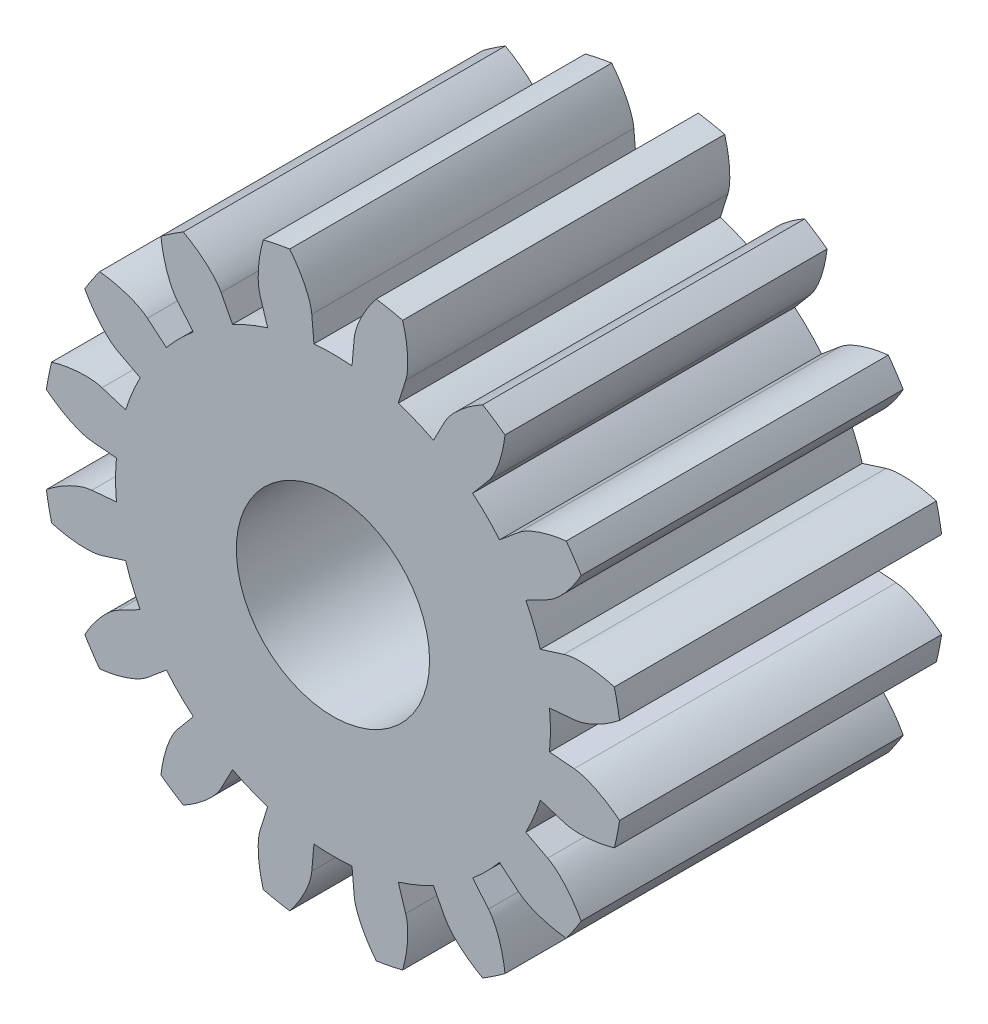
from build123d import *

# Parameters (mm, degrees)
SKETCH_1_R               = 4.5
SKETCH_1_R_2             = 1.5
EXTRUDE_1_DEPTH          = 5
CUT_EXTRUDE_1_DEPTH      = 9.093207028
PATTERN_CIRCULAR_1_COUNT = 16
PATTERN_CIRCULAR_1_ANGLE = 337.5


with BuildPart() as part:
    # 草图1 → 凸台-拉伸1 (new body)
    with BuildSketch(Plane.XY):
        Circle(SKETCH_1_R)
        Circle(SKETCH_1_R_2, mode=Mode.SUBTRACT)
    extrude(amount=EXTRUDE_1_DEPTH)

    # 草图1<3> → 切除-拉伸1 (cut, through all)
    with BuildSketch(Plane.XY):
        with BuildLine():
            Line((3.744337803, 0.329074401), (3.362040897, 0.295475903))
            ThreePointArc((3.362040897, 0.295475903), (3.371758668, 0.147879975), (3.375, 0))
            ThreePointArc((3.375, 0), (3.371758668, -0.147879975), (3.362040897, -0.295475903))
            Line((3.362040897, -0.295475903), (3.744337803, -0.329074401))
            add(Edge.make_bspline(
                [(3.744337803, -0.329074401), (3.772879878, -0.331582846), (3.852010051, -0.344515168), (3.998053748, -0.392622231), (4.176593354, -0.48016265), (4.319250266, -0.572875861), (4.413779393, -0.643953083), (4.449506423, -0.672229565)],
                knots=[0, 0, 0, 0, 0, 0.005604068, 0.015718248, 0.029959916, 0.038889728, 0.038889728, 0.038889728, 0.038889728, 0.038889728], degree=4))
            ThreePointArc((4.449506423, -0.672229565), (4.48735885, -0.337061637), (4.5, 0))
            ThreePointArc((4.5, 0), (4.48735885, 0.337061637), (4.449506423, 0.672229565))
            add(Edge.make_bspline(
                [(3.744337803, 0.329074401), (3.772879878, 0.331582846), (3.852010051, 0.344515168), (3.998053748, 0.392622231), (4.176593354, 0.48016265), (4.319250266, 0.572875861), (4.413779393, 0.643953083), (4.449506423, 0.672229565)],
                knots=[0, 0, 0, 0, 0, 0.005604068, 0.015718248, 0.029959916, 0.038889728, 0.038889728, 0.038889728, 0.038889728, 0.038889728], degree=4))
        make_face()
    cut_extrude_1 = extrude(amount=CUT_EXTRUDE_1_DEPTH, mode=Mode.SUBTRACT)

    # 阵列(圆周)1: 切除-拉伸1 ×16 about axis
    pattern_circular_1_axis = Axis((0, 0, 5), (0, 0, 1))
    for i in range(1, PATTERN_CIRCULAR_1_COUNT):
        add(cut_extrude_1.rotate(pattern_circular_1_axis, i * PATTERN_CIRCULAR_1_ANGLE / (PATTERN_CIRCULAR_1_COUNT - 1)), mode=Mode.SUBTRACT)


solid = part.part
